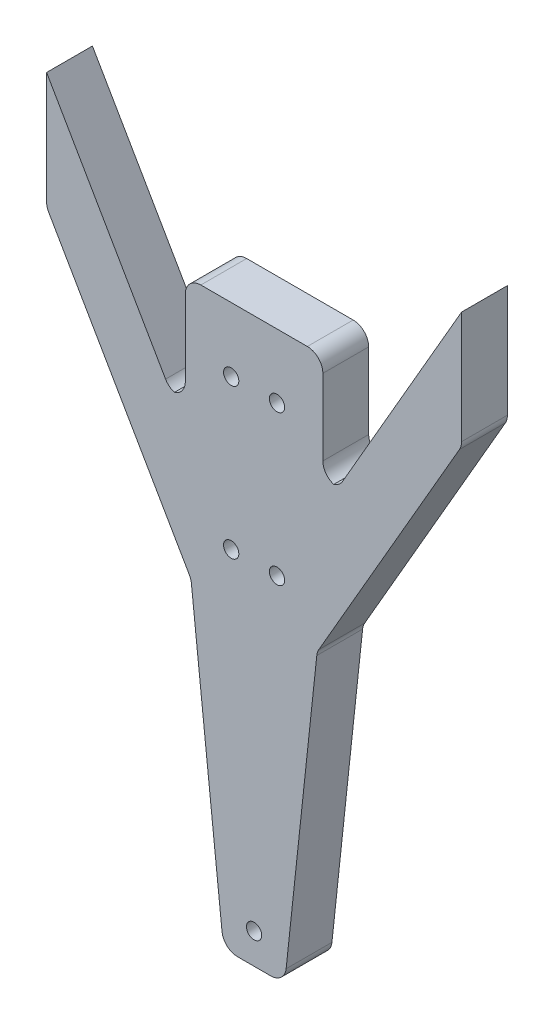
from build123d import *

# Parameters (mm, degrees)
BOSS_EXTRUDE1_DEPTH   = 15
FILLET1_R             = 5.08
F_5_0MM_DOWEL_HOLE1_D = 5
SKETCH16_R            = 5.5
CUT_EXTRUDE2_DEPTH    = 5
SKETCH14_R            = 2.5
CUT_EXTRUDE1_DEPTH    = 139.704015318
LPATTERN2_COUNT       = 2
LPATTERN2_PITCH       = 49


with BuildPart() as part:
    # Sketch1 → Boss-Extrude1 (new body)
    with BuildSketch(Plane.XY):
        Polygon((27.510468203, 50), (67.924987047, 120), (67.924987047, 81.9), (20.64, 0), (10, -99.432340815), (-10, -99.432340815), (-20.64, 0), (-67.924987047, 81.9), (-67.924987047, 120), (-27.510468203, 50), (-22.510468203, 50), (-22.510468203, 85), (22.510468203, 85), (22.510468203, 50), align=None)
    extrude(amount=BOSS_EXTRUDE1_DEPTH)

    # Fillet1
    # the kernel refuses this fillet: 5.08 mm, written as the material it adds along each edge
    with BuildSketch(Plane(origin=(20.64, 0, 0), x_dir=(0.5000000000000017, 0.8660254037844377, 0), z_dir=(0, 0, 1)), Plane(origin=(-20.64, 0, 0), x_dir=(0.10639999999998911, -0.9943234081524995, 0), z_dir=(0, 0, 1))) as fillet1_piece_1:
        with BuildLine():
            CenterArc((FILLET1_R * 0.211573226201, -FILLET1_R), FILLET1_R, 90, 23.892167456)
            Line((-FILLET1_R * 0.193443374913, -FILLET1_R * 0.0856906689624), (0, 0))
            Line((0, 0), (FILLET1_R * 0.211573226201, 0))
        make_face()
    extrude(amount=15)
    with BuildSketch(Plane(origin=(27.510468203, 50, 0), x_dir=(0.4999999999999992, 0.8660254037844392, 0), z_dir=(0, 0, 1))) as fillet1_piece_2:
        with BuildLine():
            CenterArc((FILLET1_R * 0.57735026919, FILLET1_R), FILLET1_R, 210, 60)
            Line((-FILLET1_R * 0.288675134595, FILLET1_R * 0.5), (0, 0))
            Line((0, 0), (FILLET1_R * 0.57735026919, 0))
        make_face()
    extrude(amount=15)
    with BuildSketch(Plane(origin=(22.510468203, 50, 0), x_dir=(0, 1, 0), z_dir=(0, 0, 1)), Plane(origin=(-22.510468203, 50, 0), x_dir=(-1, 0, 0), z_dir=(0, 0, 1))) as fillet1_piece_3:
        with BuildLine():
            CenterArc((FILLET1_R, -FILLET1_R), FILLET1_R, 90, 90)
            Line((0, -FILLET1_R), (0, 0))
            Line((0, 0), (FILLET1_R, 0))
        make_face()
    extrude(amount=15)
    with BuildSketch(Plane(origin=(-27.510468203, 50, 0), x_dir=(-0.5000000000000053, 0.8660254037844356, 0), z_dir=(0, 0, 1))) as fillet1_piece_4:
        with BuildLine():
            CenterArc((FILLET1_R * 0.57735026919, -FILLET1_R), FILLET1_R, 90, 60)
            Line((-FILLET1_R * 0.288675134595, -FILLET1_R * 0.5), (0, 0))
            Line((0, 0), (FILLET1_R * 0.57735026919, 0))
        make_face()
    extrude(amount=15)
    # the kernel refuses this fillet: 5.08 mm, written as the material it takes off along each edge
    with BuildSketch(Plane(origin=(-10, -99.432340815, -11.413509837), x_dir=(-0.10639999999999113, 0.9943234081524995, 0), z_dir=(0, 0, 1)), Plane(origin=(10, -99.432340815, -11.413509837), x_dir=(-1, 0, 0), z_dir=(0, 0, 1))) as fillet1_2_piece_1:
        with BuildLine():
            CenterArc((FILLET1_R * 0.89870156196, -FILLET1_R), FILLET1_R, 90, 83.892167456)
            Line((-FILLET1_R * 0.0956218461925, -FILLET1_R * 0.8936), (0, 0))
            Line((0, 0), (FILLET1_R * 0.89870156196, 0))
        make_face()
    extrude(amount=37.827019674, mode=Mode.SUBTRACT)
    with BuildSketch(Plane(origin=(67.924987047, 81.9, -3.402954744), x_dir=(-0.4999999999999986, -0.8660254037844396, 0), z_dir=(0, 0, 1)), Plane(origin=(-67.924987047, 81.9, -3.402954744), x_dir=(0, 1, 0), z_dir=(0, 0, 1))) as fillet1_2_piece_2:
        with BuildLine():
            CenterArc((FILLET1_R * 0.267949192431, -FILLET1_R), FILLET1_R, 90, 30)
            Line((-FILLET1_R * 0.232050807569, -FILLET1_R * 0.133974596216), (0, 0))
            Line((0, 0), (FILLET1_R * 0.267949192431, 0))
        make_face()
    extrude(amount=21.805909488, mode=Mode.SUBTRACT)
    with BuildSketch(Plane(origin=(-22.510468203, 85, -12.7), x_dir=(1, 0, 0), z_dir=(0, 0, 1)), Plane(origin=(22.510468203, 85, -12.7), x_dir=(0, -1, 0), z_dir=(0, 0, 1))) as fillet1_2_piece_3:
        with BuildLine():
            CenterArc((FILLET1_R, -FILLET1_R), FILLET1_R, 90, 90)
            Line((0, -FILLET1_R), (0, 0))
            Line((0, 0), (FILLET1_R, 0))
        make_face()
    extrude(amount=40.4, mode=Mode.SUBTRACT)

    # Ø5.0mm Dowel Hole1 (through all)
    with Locations(Plane(origin=(0, 0, 0), x_dir=(-1, 0, 0), z_dir=(0, 0, -1))):
        with Locations((7.5, 15), (-7.5, 15)):
            f_5_0mm_dowel_hole1 = Hole(F_5_0MM_DOWEL_HOLE1_D / 2)

    # Sketch16 → Cut-Extrude2 (cut)
    with BuildSketch(Plane(origin=(0, 0, 0), x_dir=(-1, 0, 0), z_dir=(0, 0, -1))):
        with Locations((-7.5, 15)):
            Circle(SKETCH16_R)
        with Locations((7.5, 15)):
            Circle(SKETCH16_R)
    cut_extrude2 = extrude(amount=-CUT_EXTRUDE2_DEPTH, mode=Mode.SUBTRACT)

    # Sketch14 → Cut-Extrude1 (cut, through all)
    with BuildSketch(Plane.XY.offset(15)):
        with Locations((0, -89.432340815)):
            Circle(SKETCH14_R)
    extrude(amount=-CUT_EXTRUDE1_DEPTH, mode=Mode.SUBTRACT)

    # LPattern2: Ø5.0mm Dowel Hole1, Cut-Extrude2 ×2
    with Locations(*[(0, i * LPATTERN2_PITCH, 0) for i in range(1, LPATTERN2_COUNT)]):
        add(f_5_0mm_dowel_hole1, mode=Mode.SUBTRACT)
        add(cut_extrude2, mode=Mode.SUBTRACT)


solid = part.part
